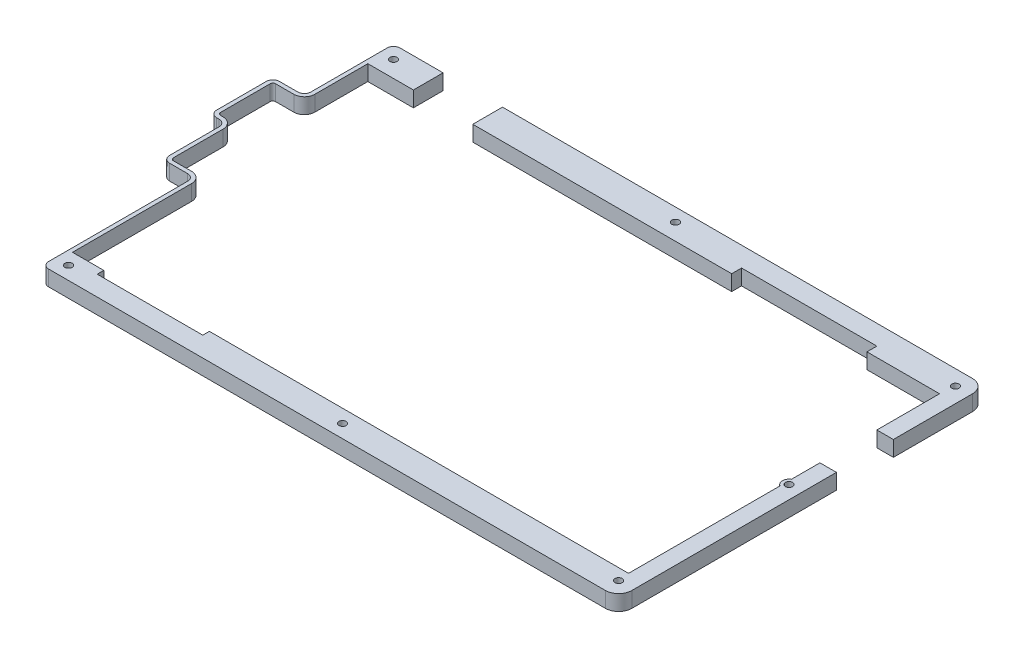
from build123d import *

# Parameters (mm, degrees)
SKETCH1_R             = 1.1
BOSS_EXTRUDE2_DEPTH   = 4.7
BOSS_EXTRUDE2_2_DEPTH = 4.7
BODY_MOVE_COPY1_ANGLE = 180


with BuildPart() as part:
    # Sketch1 → Boss-Extrude2 (new body)
    with BuildSketch(Plane(origin=(0, 0, 0), x_dir=(1, 0, 0), z_dir=(0, 1, 0))):
        with BuildLine():
            ThreePointArc((140.419647052, 29.751786673), (139.833860614, 31.166000236), (138.419647052, 31.751786673))
            Line((138.419647052, 31.751786673), (125.419647052, 31.751786673))
            Line((125.419647052, 31.751786673), (125.419647052, 22.751786673))
            Line((125.419647052, 22.751786673), (139.220593636, 22.751786673))
            Line((139.220593636, 22.751786673), (139.220593636, 6.701786673))
            ThreePointArc((139.220593636, 6.701786673), (140.157574688, 4.43971431), (142.419647052, 3.502733258))
            Line((142.419647052, 3.502733258), (147.949647052, 3.502733258))
            ThreePointArc((147.949647052, 3.502733258), (148.516001813, 3.268141435), (148.750593636, 2.701786673))
            Line((148.750593636, 2.701786673), (148.750593636, -12.348213327))
            ThreePointArc((148.750593636, -12.348213327), (148.516001813, -12.914568088), (147.949647052, -13.149159912))
            Line((147.949647052, -13.149159912), (147.189647052, -13.149159912))
            ThreePointArc((147.189647052, -13.149159912), (144.927574688, -14.086140963), (143.990593636, -16.348213327))
            Line((143.990593636, -16.348213327), (143.990593636, -31.398213327))
            ThreePointArc((143.990593636, -31.398213327), (143.756001813, -31.964568088), (143.189647052, -32.199159912))
            Line((143.189647052, -32.199159912), (137.669647052, -32.199159912))
            ThreePointArc((137.669647052, -32.199159912), (135.407574688, -33.136140963), (134.470593636, -35.398213327))
            Line((134.470593636, -35.398213327), (134.470593636, -71.498213327))
            Line((134.470593636, -71.498213327), (124.979647052, -71.498213327))
            Line((124.979647052, -71.498213327), (124.979647052, -73.498213327))
            Line((124.979647052, -73.498213327), (92.979647052, -73.498213327))
            Line((92.979647052, -73.498213327), (92.979647052, -71.498213327))
            Line((92.979647052, -71.498213327), (-34.020352948, -71.498213327))
            Line((-34.020352948, -71.498213327), (-34.020352948, -25.600264134))
            ThreePointArc((-34.020352948, -25.600264134), (-33.020352948, -23.868213327), (-34.020352948, -22.136162519))
            Line((-34.020352948, -22.136162519), (-34.020352948, -13.498213327))
            Line((-34.020352948, -13.498213327), (-39.020352948, -13.498213327))
            Line((-39.020352948, -13.498213327), (-39.020352948, -75.498213327))
            ThreePointArc((-39.020352948, -75.498213327), (-37.848780073, -78.326640452), (-35.020352948, -79.498213327))
            Line((-35.020352948, -79.498213327), (133.669647052, -79.498213327))
            ThreePointArc((133.669647052, -79.498213327), (135.083860614, -78.912426889), (135.669647052, -77.498213327))
            Line((135.669647052, -77.498213327), (135.669647052, -35.398213327))
            ThreePointArc((135.669647052, -35.398213327), (136.255433489, -33.983999764), (137.669647052, -33.398213327))
            Line((137.669647052, -33.398213327), (143.189647052, -33.398213327))
            ThreePointArc((143.189647052, -33.398213327), (144.603860614, -32.812426889), (145.189647052, -31.398213327))
            Line((145.189647052, -31.398213327), (145.189647052, -16.348213327))
            ThreePointArc((145.189647052, -16.348213327), (145.775433489, -14.933999764), (147.189647052, -14.348213327))
            Line((147.189647052, -14.348213327), (147.949647052, -14.348213327))
            ThreePointArc((147.949647052, -14.348213327), (149.363860614, -13.762426889), (149.949647052, -12.348213327))
            Line((149.949647052, -12.348213327), (149.949647052, 2.701786673))
            ThreePointArc((149.949647052, 2.701786673), (149.363860614, 4.116000236), (147.949647052, 4.701786673))
            Line((147.949647052, 4.701786673), (142.419647052, 4.701786673))
            ThreePointArc((142.419647052, 4.701786673), (141.005433489, 5.287573111), (140.419647052, 6.701786673))
            Line((140.419647052, 6.701786673), (140.419647052, 29.751786673))
        make_face()
        with Locations((-34.420352948, -74.898213327)):
            Circle(SKETCH1_R, mode=Mode.SUBTRACT)
        with Locations((48.629647052, -75.498213327)):
            Circle(SKETCH1_R, mode=Mode.SUBTRACT)
        with Locations((131.649647052, -75.498213327)):
            Circle(SKETCH1_R, mode=Mode.SUBTRACT)
        with Locations((-35.020352948, -23.868213327)):
            Circle(SKETCH1_R, mode=Mode.SUBTRACT)
        with Locations((136.439647052, 27.751786673)):
            Circle(SKETCH1_R, mode=Mode.SUBTRACT)
    extrude(amount=-BOSS_EXTRUDE2_DEPTH)


with BuildPart() as body_2:
    # Sketch1 → Boss-Extrude2 2 (new body)
    with BuildSketch(Plane(origin=(0, 0, 0), x_dir=(1, 0, 0), z_dir=(0, 1, 0))):
        with BuildLine():
            Line((107.419647052, 31.751786673), (-35.020352948, 31.751786673))
            ThreePointArc((-35.020352948, 31.751786673), (-37.848780073, 30.580213798), (-39.020352948, 27.751786673))
            Line((-39.020352948, 27.751786673), (-39.020352948, 3.751786673))
            Line((-39.020352948, 3.751786673), (-34.020352948, 3.751786673))
            Line((-34.020352948, 3.751786673), (-34.020352948, 22.751786673))
            Line((-34.020352948, 22.751786673), (-12.020352948, 22.751786673))
            Line((-12.020352948, 22.751786673), (-12.020352948, 25.751786673))
            Line((-12.020352948, 25.751786673), (28.979647052, 25.751786673))
            Line((28.979647052, 25.751786673), (28.979647052, 22.751786673))
            Line((28.979647052, 22.751786673), (107.419647052, 22.751786673))
            Line((107.419647052, 22.751786673), (107.419647052, 31.751786673))
        make_face()
        with Locations((-34.420352948, 27.151786673)):
            Circle(SKETCH1_R, mode=Mode.SUBTRACT)
        with Locations((51.009647052, 27.751786673)):
            Circle(SKETCH1_R, mode=Mode.SUBTRACT)
    extrude(amount=-BOSS_EXTRUDE2_2_DEPTH)


with BuildPart() as body_2_1:
    # Body-Move/Copy1: moved
    add(body_2.part.rotate(Axis((55.464647052, -2.35, 0), (0, 0, 1)), BODY_MOVE_COPY1_ANGLE))


with BuildPart() as part_1:
    # Body-Move/Copy1: moved
    add(part.part.rotate(Axis((55.464647052, -2.35, 0), (0, 0, 1)), BODY_MOVE_COPY1_ANGLE))


solid = Compound([body_2_1.part, part_1.part])
